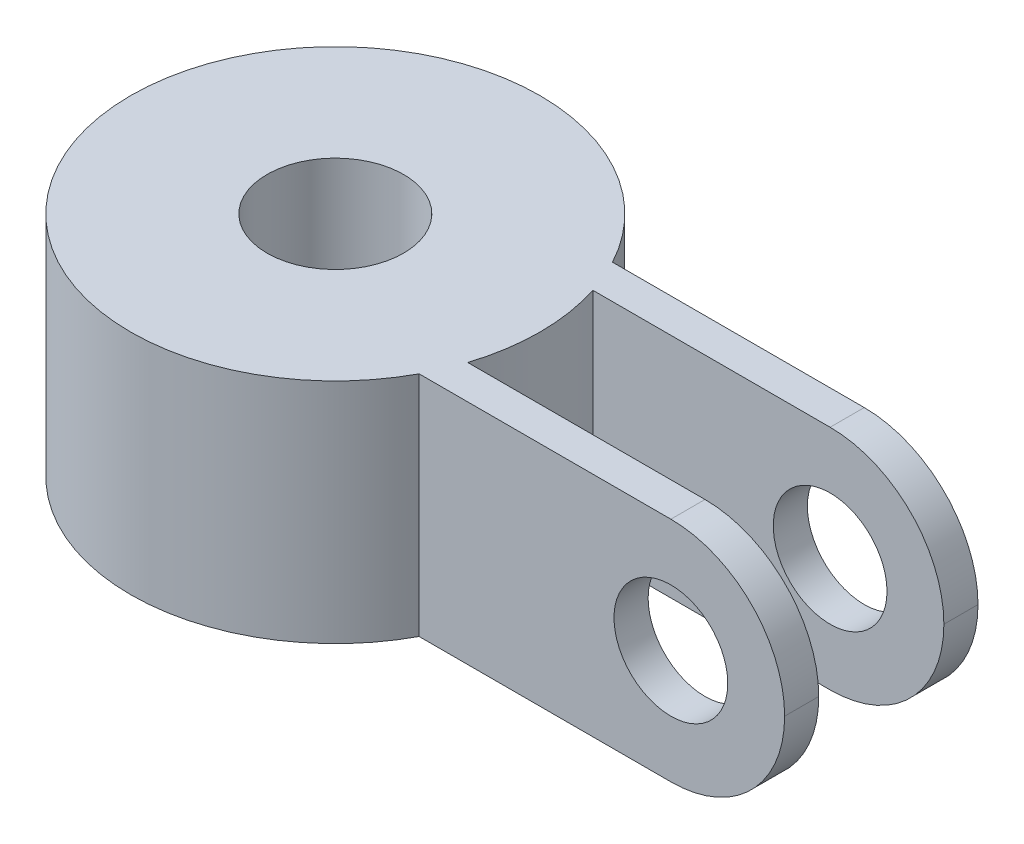
from build123d import *

# Parameters (mm, degrees)
SKETCH1_R           = 9
SKETCH1_R_2         = 3
BOSS_EXTRUDE1_DEPTH = 10
BOSS_EXTRUDE3_DEPTH = 10
FILLET1_R           = 5
SKETCH6_R           = 2.5
CUT_EXTRUDE2_DEPTH  = 25


with BuildPart() as part:
    # Sketch1 → Boss-Extrude1 (new body)
    with BuildSketch(Plane(origin=(0, 0, 0), x_dir=(1, 0, 0), z_dir=(0, 1, 0))):
        with Locations(Location((0, 0, 0), (0, 0, 270))):
            Circle(SKETCH1_R)
        with Locations(Location((0, 0, 0), (0, 0, 270))):
            Circle(SKETCH1_R_2, mode=Mode.SUBTRACT)
    extrude(amount=BOSS_EXTRUDE1_DEPTH)

    # Sketch5 → Boss-Extrude3 (add)
    with BuildSketch(Plane.XZ):
        Polygon((7.933315826, 4.25), (24, 4.25), (24, 2.75), (7.137975048, 2.75), align=None)
        Polygon((7.137975048, -2.75), (7.933315826, -4.25), (24, -4.25), (24, -2.75), align=None)
    extrude(amount=-BOSS_EXTRUDE3_DEPTH)

    # Fillet1
    fillet1_edges = [part.edges().sort_by_distance(p)[0] for p in [
        (24, 0, -3.5),
        (24, 10, -3.5),
        (24, 10, 3.5),
        (24, 0, 3.5),
    ]]
    fillet(fillet1_edges, radius=FILLET1_R - 0.0001)  # a hair under: the kernel refuses the full size

    # Sketch6 → Cut-Extrude2 (cut)
    with BuildSketch(Plane.XY.offset(4.25)):
        with Locations((19, 5)):
            Circle(SKETCH6_R)
    extrude(amount=-CUT_EXTRUDE2_DEPTH, mode=Mode.SUBTRACT)


solid = part.part
